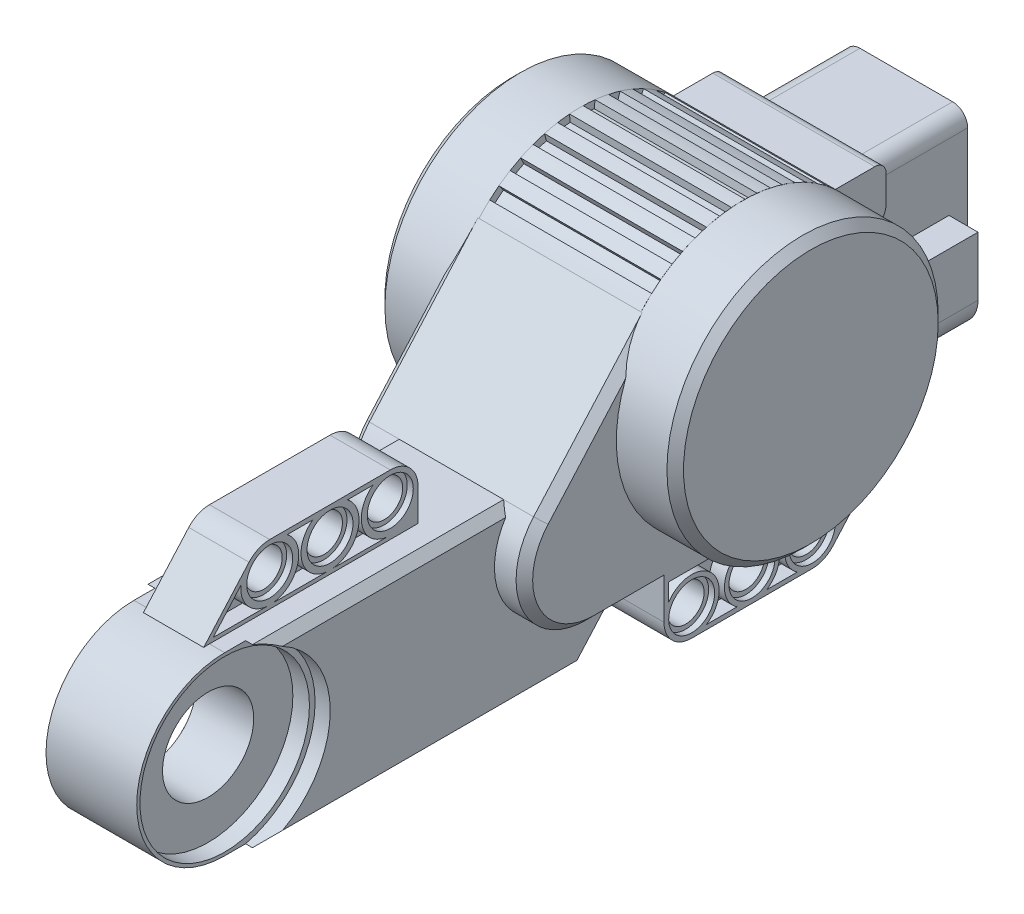
from build123d import *

# Parameters (mm, degrees)
SKETCH3_R                              = 18
MOTOR_BODY_DEPTH                       = 19.815
SKETCH4_R                              = 2.45
FRONT_TOP_PEG_TAB_DEPTH                = 4
SKETCH5_R                              = 3.05
PEG_COUNTERBORE_CUT_DEPTH              = 0.8
PEG_COUNTERBORE_LIN_PATTERN_COUNT      = 3
PEG_COUNTERBORE_LIN_PATTERN_PITCH      = 8
PEG_COUNTERBORE_MIRROR_COPY_1_SKETCH_R = 3.05
PEG_COUNTERBORE_MIRROR_COPY_1_DEPTH    = 0.8
PEG_COUNTERBORE_MIRROR_COPY_2_SKETCH_R = 3.05
PEG_COUNTERBORE_MIRROR_COPY_2_DEPTH    = 0.8
BODY_MOVE_COPY2_ANGLE                  = 180
SKETCH9_W                              = 24
SKETCH9_H                              = 31.675
BOTTOM_PEG_BASE_EXT_DEPTH              = 16
BK_PEG_BODY_HOLE_CUT_DEPTH             = 10
BACK_PEG_HOLES_BODY_START              = -12
BACK_PEG_HOLES_BODY_DEPTH              = 31.675
SKETCH12_R                             = 2.45
BACK_PEG_HOLES_CUT_DEPTH               = 8
FRONT_ARM_BODY_DEPTH                   = 8.03
SKETCH14_R                             = 12
L_WHEEL_RECESS_DEPTH                   = 2.01
ANGLED_MIDFRONT_BODY_DEPTH             = 12
SKETCH16_R                             = 3.05
BACK_PEG_HOLE_CNTRBORE_DEPTH           = 0.8
BACK_PEG_HOLE_CNTRBORE_PATTERN_COUNT   = 3
BACK_PEG_HOLE_CNTRBORE_PATTERN_PITCH   = 8
CHAMFER6_SIZE                          = 1.1
EXTRUDE1_DEPTH                         = 10
SKETCH18_W                             = 16.3
SKETCH18_H                             = 18.65
JACK_BODY_DEPTH                        = 45
JACK_FILLET_R                          = 2
SKETCH20_W                             = 21.5
SKETCH20_H                             = 31.471355086
CUT_EXTRUDE1_DEPTH                     = 91.332970033
EXTRUDE2_DEPTH                         = 10.75
SKETCH23_W                             = 11.1
SKETCH23_H                             = 14.25
CUT_EXTRUDE2_DEPTH                     = 12.5
SKETCH25_W                             = 11.1
SKETCH25_H                             = 14.25
EXTRUDE5_DEPTH                         = 12.5
CUT_EXTRUDE3_DEPTH                     = 2.3
CUT_EXTRUDE4_DEPTH                     = 9.9
SKETCH27_W                             = 6
SKETCH27_H                             = 2.5
CUT_EXTRUDE5_DEPTH                     = 3
CHAMFER7_SIZE                          = 1.1
CHAMFER8_SIZE                          = 1.1
CUT_EXTRUDE6_DEPTH                     = 2
CUT_EXTRUDE7_DEPTH                     = 2
MIRROR7_COPY_1_DEPTH                   = 2
CUT_EXTRUDE10_DEPTH                    = 2
SKETCH32_R                             = 6.05
CUT_EXTRUDE11_DEPTH                    = 98.123389819
SKETCH34_R                             = 11.25
CUT_EXTRUDE12_DEPTH                    = 2.2
SKETCH35_W                             = 8
SKETCH35_H                             = 22.425401663
EXTRUDE8_DEPTH                         = 0.01


with BuildPart() as part:
    # Sketch3 → motor_body (new, symmetric)
    with BuildSketch(Plane(origin=(0, 0, 0), x_dir=(0, 0, -1), z_dir=(1, 0, 0))):
        with Locations((-8, 24)):
            Circle(SKETCH3_R)
    extrude(amount=MOTOR_BODY_DEPTH, both=True)


with BuildPart() as body_2:
    # Sketch4 → front_top_peg_tab (new, symmetric)
    with BuildSketch(Plane(origin=(0, 0, 0), x_dir=(0, 0, -1), z_dir=(1, 0, 0))):
        with BuildLine():
            Line((-64, 27.675), (-48, 27.675))
            ThreePointArc((-48, 27.675), (-45.401382579, 26.598617421), (-44.325, 24))
            Line((-44.325, 24), (-44.325, 16))
            Line((-44.325, 16), (-76, 16))
            Line((-76, 16), (-66.750401663, 26.43739937))
            ThreePointArc((-66.750401663, 26.43739937), (-65.508009004, 27.351348063), (-64, 27.675))
        make_face()
        with Locations((-64, 24)):
            Circle(SKETCH4_R, mode=Mode.SUBTRACT)
        with Locations((-56, 24)):
            Circle(SKETCH4_R, mode=Mode.SUBTRACT)
        with Locations((-48, 24)):
            Circle(SKETCH4_R, mode=Mode.SUBTRACT)
    extrude(amount=FRONT_TOP_PEG_TAB_DEPTH, both=True)

    # Sketch5 → peg_counterbore_cut (cut)
    with BuildSketch(Plane(origin=(4, 0, 0), x_dir=(0, 0, -1), z_dir=(1, 0, 0))):
        with Locations((-64, 24)):
            Circle(SKETCH5_R)
    peg_counterbore_cut = extrude(amount=-PEG_COUNTERBORE_CUT_DEPTH, mode=Mode.SUBTRACT)

    # peg_counterbore_lin_pattern: peg_counterbore_cut ×3
    with Locations(*[(0, 0, -i * PEG_COUNTERBORE_LIN_PATTERN_PITCH) for i in range(1, PEG_COUNTERBORE_LIN_PATTERN_COUNT)]):
        add(peg_counterbore_cut, mode=Mode.SUBTRACT)

    # peg_counterbore_mirror: peg_counterbore_cut across plane
    add(peg_counterbore_cut.mirror(Plane(origin=(0, 0, 0), x_dir=(0, 0, 1), z_dir=(1, 0, 0))), mode=Mode.SUBTRACT)

    # peg_counterbore_mirror copy 1 sketch → peg_counterbore_mirror copy 1 (cut)
    with BuildSketch(Plane(origin=(-4, 0, -8), x_dir=(0, 0, -1), z_dir=(-1, 0, 0))):
        with Locations((-64, -24)):
            Circle(PEG_COUNTERBORE_MIRROR_COPY_1_SKETCH_R)
    extrude(amount=-PEG_COUNTERBORE_MIRROR_COPY_1_DEPTH, mode=Mode.SUBTRACT)

    # peg_counterbore_mirror copy 2 sketch → peg_counterbore_mirror copy 2 (cut)
    with BuildSketch(Plane(origin=(-4, 0, -16), x_dir=(0, 0, -1), z_dir=(-1, 0, 0))):
        with Locations((-64, -24)):
            Circle(PEG_COUNTERBORE_MIRROR_COPY_2_SKETCH_R)
    extrude(amount=-PEG_COUNTERBORE_MIRROR_COPY_2_DEPTH, mode=Mode.SUBTRACT)


with BuildPart() as body_3:
    # Body-Move/Copy1: copy of body 2
    add(body_2.part.moved(Location((0, 0, -64))))


with BuildPart() as body_3_1:
    # Body-Move/Copy2: moved
    add(body_3.part.rotate(Axis((0, 24, 0), (1, 0, 0)), BODY_MOVE_COPY2_ANGLE))


with BuildPart() as body_3_2:
    # Body-Move/Copy3: moved
    add(body_3_1.part.moved(Location((0, -24, 0))))


with BuildPart() as body_3_3:
    # Body-Move/Copy4: moved
    add(body_3_2.part.moved(Location((8, 0, 0))))


with BuildPart() as body_4:
    # Mirror2: mirrored copy
    add(body_3_3.part.mirror(Plane(origin=(0, 0, 0), x_dir=(0, 0, 1), z_dir=(1, 0, 0))))


with BuildPart() as body_5:
    # Sketch9 → bottom_peg_base_ext (new body)
    with BuildSketch(Plane(origin=(0, 8, 0), x_dir=(-1, 0, 0), z_dir=(0, 1, 0))):
        with Locations((0, 3.8375)):
            Rectangle(SKETCH9_W, SKETCH9_H)
    extrude(amount=BOTTOM_PEG_BASE_EXT_DEPTH)


with BuildPart() as bk_peg_body_hole_cut_tool:
    # Sketch8 → bk_peg_body_hole_cut (new body)
    with BuildSketch(Plane.XY.offset(-12)):
        with BuildLine():
            Line((8, 11.675), (-8, 11.675))
            ThreePointArc((-8, 11.675), (-11.675, 8), (-8, 4.325))
            Line((-8, 4.325), (8, 4.325))
            ThreePointArc((8, 4.325), (11.675, 8), (8, 11.675))
        make_face()
    extrude(amount=BK_PEG_BODY_HOLE_CUT_DEPTH)


with BuildPart() as part_1:
    add(part.part)

    # bk_peg_body_hole_cut: cut by bk_peg_body_hole_cut_tool
    add(bk_peg_body_hole_cut_tool.part, mode=Mode.SUBTRACT)


with BuildPart() as body_3_4:
    add(body_3_3.part)

    # bk_peg_body_hole_cut: cut by bk_peg_body_hole_cut_tool
    add(bk_peg_body_hole_cut_tool.part, mode=Mode.SUBTRACT)


with BuildPart() as body_4_1:
    add(body_4.part)

    # bk_peg_body_hole_cut: cut by bk_peg_body_hole_cut_tool
    add(bk_peg_body_hole_cut_tool.part, mode=Mode.SUBTRACT)


with BuildPart() as body_5_1:
    add(body_5.part)

    # bk_peg_body_hole_cut: cut by bk_peg_body_hole_cut_tool
    add(bk_peg_body_hole_cut_tool.part, mode=Mode.SUBTRACT)


with BuildPart() as body_6:
    # Sketch11 → back_peg_holes_body (new body)
    with BuildSketch(Plane.XY.offset(BACK_PEG_HOLES_BODY_START)):
        with BuildLine():
            Line((8, 11.675), (-8, 11.675))
            ThreePointArc((-8, 11.675), (-11.675, 8), (-8, 4.325))
            Line((-8, 4.325), (8, 4.325))
            ThreePointArc((8, 4.325), (11.675, 8), (8, 11.675))
        make_face()
    extrude(amount=BACK_PEG_HOLES_BODY_DEPTH)

    # Sketch12 → back_peg_holes_cut (cut)
    with BuildSketch(Plane.XY.offset(-12)):
        with Locations((0, 8)):
            Circle(SKETCH12_R)
        with Locations((-8, 8)):
            Circle(SKETCH12_R)
        with Locations((8, 8)):
            Circle(SKETCH12_R)
    extrude(amount=BACK_PEG_HOLES_CUT_DEPTH, mode=Mode.SUBTRACT)

    # Sketch16 → back_peg_hole_cntrbore (cut)
    with BuildSketch(Plane.XY.offset(-12)):
        with Locations((8, 8)):
            Circle(SKETCH16_R)
    back_peg_hole_cntrbore = extrude(amount=BACK_PEG_HOLE_CNTRBORE_DEPTH, mode=Mode.SUBTRACT)

    # back_peg_hole_cntrbore_pattern: back_peg_hole_cntrbore ×3
    with Locations(*[(-i * BACK_PEG_HOLE_CNTRBORE_PATTERN_PITCH, 0, 0) for i in range(1, BACK_PEG_HOLE_CNTRBORE_PATTERN_COUNT)]):
        add(back_peg_hole_cntrbore, mode=Mode.SUBTRACT)

    # Sketch31 → Cut-Extrude10 (cut)
    with BuildSketch(Plane.XY.offset(-12)):
        with BuildLine():
            Line((5.751250347, 10.875), (2.248749653, 10.875))
            ThreePointArc((2.248749653, 10.875), (3.65, 8), (2.248749653, 5.125))
            Line((2.248749653, 5.125), (5.751250347, 5.125))
            ThreePointArc((5.751250347, 5.125), (4.35, 8), (5.751250347, 10.875))
        make_face()
        with BuildLine():
            Line((-5.751250347, 5.125), (-2.248749653, 5.125))
            ThreePointArc((-2.248749653, 5.125), (-3.65, 8), (-2.248749653, 10.875))
            Line((-2.248749653, 10.875), (-5.751250347, 10.875))
            ThreePointArc((-5.751250347, 10.875), (-4.35, 8), (-5.751250347, 5.125))
        make_face()
    extrude(amount=CUT_EXTRUDE10_DEPTH, mode=Mode.SUBTRACT)


with BuildPart() as body_7:
    # Sketch13 → front_arm_body (new, symmetric)
    with BuildSketch(Plane(origin=(0, 0, 0), x_dir=(0, 0, -1), z_dir=(1, 0, 0))):
        with BuildLine():
            Line((-72, 19.675), (-19.675, 19.675))
            Line((-19.675, 19.675), (-19.675, 4.325))
            Line((-19.675, 4.325), (-26.764580849, -3.675))
            Line((-26.764580849, -3.675), (-72, -3.675))
            ThreePointArc((-72, -3.675), (-83.675, 8), (-72, 19.675))
        make_face()
    extrude(amount=FRONT_ARM_BODY_DEPTH, both=True)

    # Sketch14 → l_wheel_recess (cut)
    with BuildSketch(Plane(origin=(8.03, 0, 0), x_dir=(0, 0, -1), z_dir=(1, 0, 0))):
        with Locations((-72, 8)):
            Circle(SKETCH14_R)
    l_wheel_recess = extrude(amount=-L_WHEEL_RECESS_DEPTH, mode=Mode.SUBTRACT)

    # r_wheel_recess_mirror: l_wheel_recess across plane
    add(l_wheel_recess.mirror(Plane(origin=(0, 0, 0), x_dir=(0, 0, 1), z_dir=(1, 0, 0))), mode=Mode.SUBTRACT)


with BuildPart() as body_8:
    # Sketch15 → angled_midfront_body (new, symmetric)
    with BuildSketch(Plane(origin=(0, 0, 0), x_dir=(0, 0, -1), z_dir=(1, 0, 0))):
        with BuildLine():
            Line((-19.675, 4.325), (-28.976784364, 4.325))
            ThreePointArc((-28.976784364, 4.325), (-37.392987177, 9.766940189), (-35.883837221, 19.675))
            Line((-35.883837221, 19.675), (-21.471355086, 35.938282629))
            Line((-21.471355086, 35.938282629), (-5.275310501, 4.325))
            Line((-5.275310501, 4.325), (-19.675, 4.325))
        make_face()
    extrude(amount=ANGLED_MIDFRONT_BODY_DEPTH, both=True)

    # Chamfer6
    chamfer6_edges = [body_8.edges().sort_by_distance(p)[0] for p in [
        (12, 27.806641315, 28.677596154),
        (12, 9.766940189, 37.392987177),
        (12, 4.325, 17.126047432),
        (-12, 4.325, 17.126047432),
        (-12, 9.766940189, 37.392987177),
        (-12, 27.806641315, 28.677596154),
    ]]
    chamfer(chamfer6_edges, length=CHAMFER6_SIZE)


with BuildPart() as body_2_1:
    add(body_2.part)

    # Combine1: union body 7
    add(body_7.part)

    # Combine2: union body 8, part, body 3, body 4, body 5
    add(body_8.part)
    add(part_1.part)
    add(body_3_4.part)
    add(body_4_1.part)
    add(body_5_1.part)

    # Sketch17 → Extrude1 (add)
    with BuildSketch(Plane(origin=(0, 0, -12), x_dir=(-1, 0, 0), z_dir=(0, 0, -1))):
        with BuildLine():
            Line((-8, 12.175), (8, 12.175))
            ThreePointArc((8, 12.175), (10.828427125, 13.346572875), (12, 16.175))
            Line((12, 16.175), (12, 24))
            Line((12, 24), (-12, 24))
            Line((-12, 24), (-12, 16.175))
            ThreePointArc((-12, 16.175), (-10.828427125, 13.346572875), (-8, 12.175))
        make_face()
    extrude(amount=EXTRUDE1_DEPTH)

    # Sketch20 → Cut-Extrude1 (cut, through all)
    with BuildSketch(Plane(origin=(0, 24, 0), x_dir=(-1, 0, 0), z_dir=(0, 1, 0))):
        with Locations((0, 5.735677543)):
            Rectangle(SKETCH20_W, SKETCH20_H)
    extrude(amount=CUT_EXTRUDE1_DEPTH, mode=Mode.SUBTRACT)


with BuildPart() as body_3_2_1:
    # Sketch18 → jack_body (new body)
    with BuildSketch(Plane(origin=(0, 0, -24.48), x_dir=(-1, 0, 0), z_dir=(0, 0, -1))):
        with Locations((0, 25.5)):
            Rectangle(SKETCH18_W, SKETCH18_H)
    extrude(amount=-JACK_BODY_DEPTH)

    # jack_fillet
    jack_fillet_edges = [body_3_2_1.edges().sort_by_distance(p)[0] for p in [
        (8.15, 34.825, -1.98),
        (-8.15, 34.825, -1.98),
        (-8.15, 16.175, -1.98),
        (8.15, 16.175, -1.98),
    ]]
    fillet(jack_fillet_edges, radius=JACK_FILLET_R)


with BuildPart() as body_4_2:
    # Sketch21 → Extrude2 (new, symmetric)
    with BuildSketch(Plane(origin=(0, 0, 0), x_dir=(0, 0, -1), z_dir=(1, 0, 0))):
        with BuildLine():
            Line((-21.471355086, 24), (-21.471355086, 35.938282629))
            ThreePointArc((-21.471355086, 35.938282629), (-20.787311968, 36.668253732), (-20.063771338, 37.35909507))
            Line((-20.063771338, 37.35909507), (-19.393561819, 36.616923122))
            ThreePointArc((-19.393561819, 36.616923122), (-18.825839432, 37.107295701), (-18.237035728, 37.572144248))
            Line((-18.237035728, 37.572144248), (-18.8392143, 38.370505675))
            ThreePointArc((-18.8392143, 38.370505675), (-18.10713152, 38.894492017), (-17.349765099, 39.381218827))
            Line((-17.349765099, 39.381218827), (-16.830333704, 38.52670667))
            ThreePointArc((-16.830333704, 38.52670667), (-16.180851867, 38.90213618), (-15.515439336, 39.24854654))
            Line((-15.515439336, 39.24854654), (-15.957524002, 40.145519866))
            ThreePointArc((-15.957524002, 40.145519866), (-15.140294879, 40.523201537), (-14.305203849, 40.859549354))
            Line((-14.305203849, 40.859549354), (-13.954914746, 39.922907723))
            ThreePointArc((-13.954914746, 39.922907723), (-13.246635476, 40.170121094), (-12.528139355, 40.385846148))
            Line((-12.528139355, 40.385846148), (-12.794500494, 41.349719451))
            ThreePointArc((-12.794500494, 41.349719451), (-11.921017645, 41.567743755), (-11.037726118, 41.741821215))
            Line((-11.037726118, 41.741821215), (-10.868963556, 40.756164481))
            ThreePointArc((-10.868963556, 40.756164481), (-10.126927618, 40.866421639), (-9.380749882, 40.943834565))
            Line((-9.380749882, 40.943834565), (-9.461970464, 41.940530716))
            ThreePointArc((-9.461970464, 41.940530716), (-8.563115321, 41.991189542), (-7.662851509, 41.996842248))
            Line((-7.662851509, 41.996842248), (-7.681581981, 40.997017679))
            ThreePointArc((-7.681581981, 40.997017679), (-6.932023584, 40.966420553), (-6.184544874, 40.902784465))
            Line((-6.184544874, 40.902784465), (-6.077753395, 41.897065905))
            ThreePointArc((-6.077753395, 41.897065905), (-5.185304412, 41.778568242), (-4.299896571, 41.615596346))
            Line((-4.299896571, 41.615596346), (-4.505457873, 40.636952104))
            ThreePointArc((-4.505457873, 40.636952104), (-3.774877179, 40.466582437), (-3.052524128, 40.264147149))
            Line((-3.052524128, 40.264147149), (-2.761496136, 41.220861688))
            ThreePointArc((-2.761496136, 41.220861688), (-1.907005279, 40.937396947), (-1.067756441, 40.611562216))
            Line((-1.067756441, 40.611562216), (-1.452881083, 39.688697648))
            ThreePointArc((-1.452881083, 39.688697648), (-0.767107309, 39.38457875), (-0.095418253, 39.050501234))
            Line((-0.095418253, 39.050501234), (0.369557144, 39.935824836))
            ThreePointArc((0.369557144, 39.935824836), (1.155879893, 39.497414732), (1.919298618, 39.020236847))
            Line((1.919298618, 39.020236847), (1.368226472, 38.185779244))
            ThreePointArc((1.368226472, 38.185779244), (1.984948231, 37.758663046), (2.582226153, 37.3047544))
            Line((2.582226153, 37.3047544), (3.204710044, 38.087387012))
            ThreePointArc((3.204710044, 38.087387012), (3.768455249, 37.61996553), (4.312721064, 37.13))
            Line((4.312721064, 37.13), (9.55, 37.13))
            ThreePointArc((9.55, 37.13), (10.610660172, 36.690660172), (11.05, 35.63))
            Line((11.05, 35.63), (11.05, 32.062430634))
            ThreePointArc((11.05, 32.062430634), (10.479354691, 30.542036776), (9.049263645, 29.772573876))
            Line((9.049263645, 29.772573876), (9.049263645, 24))
            Line((9.049263645, 24), (-21.471355086, 24))
        make_face()
    extrude(amount=EXTRUDE2_DEPTH, both=True)

    # Combine3: union body 3 2
    add(body_3_2_1.part)


with BuildPart() as cut_extrude2_tool:
    # Sketch23 → Cut-Extrude2 (new body)
    with BuildSketch(Plane(origin=(0, 0, -24.48), x_dir=(-1, 0, 0), z_dir=(0, 0, -1))):
        with Locations((0, 25.1)):
            Rectangle(SKETCH23_W, SKETCH23_H)
    extrude(amount=-CUT_EXTRUDE2_DEPTH)


with BuildPart() as body_2_2:
    add(body_2_1.part)

    # Cut-Extrude2: cut by cut_extrude2_tool
    add(cut_extrude2_tool.part, mode=Mode.SUBTRACT)

    # Chamfer7
    chamfer7_edges = [body_2_2.edges().sort_by_distance(p)[0] for p in [
        (-19.815, 24, 26),
        (19.815, 24, 26),
    ]]
    chamfer(chamfer7_edges, length=CHAMFER7_SIZE)

    # Chamfer8
    # the kernel refuses this chamfer: 1.1 mm, written as the material it takes off along each edge
    with BuildSketch(Plane(origin=(-8.03, 19.675, 72.054977641), x_dir=(0.9996219169112966, 0.02749587661058657, 0), z_dir=(0, 0, -1))) as chamfer8_piece_1_section:
        Polygon((CHAMFER8_SIZE * 0.999621916911, CHAMFER8_SIZE * 0.0274958766106), (-CHAMFER8_SIZE * 0.0274958766106, CHAMFER8_SIZE * 0.999621916911), (0, 0), align=None)
    chamfer8_piece_1 = extrude(amount=38.999991707, mode=Mode.PRIVATE)
    chamfer8_piece_1 = chamfer8_piece_1 - Plane(origin=(-7.66621157, 13.553986292, 28.976784364), x_dir=(0, -1, 0), z_dir=(1, 0, 0)) * Cylinder(9.228986292, 83, mode=Mode.PRIVATE)
    add(chamfer8_piece_1, mode=Mode.SUBTRACT)
    with BuildSketch(Plane(origin=(-8.03, -3.675, 23.935729563), x_dir=(-0.02749587661058658, 0.9996219169112966, 0), z_dir=(0, 0, 1))) as chamfer8_piece_2:
        Polygon((CHAMFER8_SIZE * 0.999621916911, -CHAMFER8_SIZE * 0.0274958766106), (-CHAMFER8_SIZE * 0.0274958766106, -CHAMFER8_SIZE * 0.999621916911), (0, 0), align=None)
    extrude(amount=48.119248079, mode=Mode.SUBTRACT)
    with BuildSketch(Plane(origin=(-8.03, 6.442136676, 17.798798546), x_dir=(0.9996219169112966, -0.018236308117804544, -0.02057815095719529), z_dir=(0, -0.7484086159039549, 0.6632379238559316))) as chamfer8_piece_3_section:
        Polygon((CHAMFER8_SIZE * 0.999621916911, CHAMFER8_SIZE * 0.0274958766106), (-CHAMFER8_SIZE * 0.0274958766106, CHAMFER8_SIZE * 0.999621916911), (0, 0), align=None)
    chamfer8_piece_3 = extrude(amount=16.347050384, mode=Mode.PRIVATE)
    chamfer8_piece_3 = split(chamfer8_piece_3, bisect_by=Plane(origin=(-7.664513122, -0.615510317, 19.675), z_dir=(0, 0, 1)), keep=Keep.TOP, mode=Mode.PRIVATE)
    chamfer8_piece_3 = split(chamfer8_piece_3, bisect_by=Plane(origin=(-7.664513122, 4.325, 24.531154905), z_dir=(0, -1, 0)), keep=Keep.TOP, mode=Mode.PRIVATE)
    add(chamfer8_piece_3, mode=Mode.SUBTRACT)
    with BuildSketch(Plane(origin=(8.03, -3.675, 23.935729563), x_dir=(0.02749587661058658, 0.9996219169112966, 0), z_dir=(0, 0, 1))) as chamfer8_piece_4:
        Polygon((CHAMFER8_SIZE * 0.999621916911, CHAMFER8_SIZE * 0.0274958766106), (-CHAMFER8_SIZE * 0.0274958766106, CHAMFER8_SIZE * 0.999621916911), (0, 0), align=None)
    extrude(amount=48.119248079, mode=Mode.SUBTRACT)
    with BuildSketch(Plane(origin=(8.03, 6.442136676, 17.798798546), x_dir=(-0.9996219169112966, -0.018236308117804544, -0.02057815095719529), z_dir=(0, -0.7484086159039549, 0.6632379238559316))) as chamfer8_piece_5_section:
        Polygon((CHAMFER8_SIZE * 0.999621916911, -CHAMFER8_SIZE * 0.0274958766106), (-CHAMFER8_SIZE * 0.0274958766106, -CHAMFER8_SIZE * 0.999621916911), (0, 0), align=None)
    chamfer8_piece_5 = extrude(amount=16.347050384, mode=Mode.PRIVATE)
    chamfer8_piece_5 = split(chamfer8_piece_5, bisect_by=Plane(origin=(7.664513122, -0.615510317, 19.675), z_dir=(0, 0, 1)), keep=Keep.TOP, mode=Mode.PRIVATE)
    chamfer8_piece_5 = split(chamfer8_piece_5, bisect_by=Plane(origin=(7.664513122, 4.325, 24.531154905), z_dir=(0, -1, 0)), keep=Keep.TOP, mode=Mode.PRIVATE)
    add(chamfer8_piece_5, mode=Mode.SUBTRACT)
    with BuildSketch(Plane(origin=(8.03, 19.675, 72.054977641), x_dir=(-0.9996219169112966, 0.02749587661058657, 0), z_dir=(0, 0, -1))) as chamfer8_piece_6_section:
        Polygon((CHAMFER8_SIZE * 0.999621916911, -CHAMFER8_SIZE * 0.0274958766106), (-CHAMFER8_SIZE * 0.0274958766106, -CHAMFER8_SIZE * 0.999621916911), (0, 0), align=None)
    chamfer8_piece_6 = extrude(amount=38.999991707, mode=Mode.PRIVATE)
    chamfer8_piece_6 = chamfer8_piece_6 - Plane(origin=(7.66621157, 13.553986292, 28.976784364), x_dir=(0, -1, 0), z_dir=(1, 0, 0)) * Cylinder(9.228986292, 83, mode=Mode.PRIVATE)
    add(chamfer8_piece_6, mode=Mode.SUBTRACT)

    # Sketch28 → Cut-Extrude6 (cut)
    with BuildSketch(Plane(origin=(4, 0, 0), x_dir=(0, 0, -1), z_dir=(1, 0, 0))):
        with BuildLine():
            Line((-58.316651679, 27.075), (-61.683348321, 27.075))
            ThreePointArc((-61.683348321, 27.075), (-60.285222051, 22.988602554), (-63.561964613, 20.175))
            Line((-63.561964613, 20.175), (-56.438035387, 20.175))
            ThreePointArc((-56.438035387, 20.175), (-59.714777949, 22.988602554), (-58.316651679, 27.075))
        make_face()
        with BuildLine():
            Line((-64.438035387, 20.175), (-71.498423908, 20.175))
            Line((-71.498423908, 20.175), (-67.837847744, 24.30565454))
            ThreePointArc((-67.837847744, 24.30565454), (-66.972603382, 21.553343274), (-64.438035387, 20.175))
        make_face()
        with BuildLine():
            Line((-48.438035387, 20.175), (-55.561964613, 20.175))
            ThreePointArc((-55.561964613, 20.175), (-52.285222051, 22.988602554), (-53.683348321, 27.075))
            Line((-53.683348321, 27.075), (-50.316651679, 27.075))
            ThreePointArc((-50.316651679, 27.075), (-51.714777949, 22.988602554), (-48.438035387, 20.175))
        make_face()
    cut_extrude6 = extrude(amount=-CUT_EXTRUDE6_DEPTH, mode=Mode.SUBTRACT)

    # Mirror3: Cut-Extrude6 across plane
    add(cut_extrude6.mirror(Plane(origin=(0, 0, 0), x_dir=(0, 0, 1), z_dir=(1, 0, 0))), mode=Mode.SUBTRACT)

    # Sketch29 → Cut-Extrude7 (cut)
    with BuildSketch(Plane(origin=(12, 0, 0), x_dir=(0, 0, -1), z_dir=(1, 0, 0))):
        with BuildLine():
            Line((-19.075, 4.325), (7.674289016, 4.325))
            Line((7.674289016, 4.325), (3.643130822, -0.223825416))
            ThreePointArc((3.643130822, -0.223825416), (-1.653821199, 3.253824741), (-1.966437133, -3.075))
            Line((-1.966437133, -3.075), (-6.033562867, -3.075))
            ThreePointArc((-6.033562867, -3.075), (-8, 3.65), (-9.966437133, -3.075))
            Line((-9.966437133, -3.075), (-14.033562867, -3.075))
            ThreePointArc((-14.033562867, -3.075), (-13.419060249, 2.580939751), (-19.075, 1.966437133))
            Line((-19.075, 1.966437133), (-19.075, 4.325))
        make_face()
    cut_extrude7 = extrude(amount=-CUT_EXTRUDE7_DEPTH, mode=Mode.SUBTRACT)

    # Mirror4: Cut-Extrude7 across plane
    add(cut_extrude7.mirror(Plane(origin=(0, 0, 0), x_dir=(0, 0, 1), z_dir=(1, 0, 0))), mode=Mode.SUBTRACT)

    # Mirror6: Cut-Extrude7 across plane
    add(cut_extrude7.mirror(Plane(origin=(8.075, 0, 0), x_dir=(0, 0, 1), z_dir=(1, 0, 0))), mode=Mode.SUBTRACT)

    # Mirror7 copy 1 sketch → Mirror7 copy 1 (cut)
    with BuildSketch(Plane(origin=(-4.15, 0, 0), x_dir=(0, 0, -1), z_dir=(1, 0, 0))):
        with BuildLine():
            Line((-19.075, 4.325), (7.674289016, 4.325))
            Line((7.674289016, 4.325), (3.643130822, -0.223825416))
            ThreePointArc((3.643130822, -0.223825416), (-1.653821199, 3.253824741), (-1.966437133, -3.075))
            Line((-1.966437133, -3.075), (-6.033562867, -3.075))
            ThreePointArc((-6.033562867, -3.075), (-8, 3.65), (-9.966437133, -3.075))
            Line((-9.966437133, -3.075), (-14.033562867, -3.075))
            ThreePointArc((-14.033562867, -3.075), (-13.419060249, 2.580939751), (-19.075, 1.966437133))
            Line((-19.075, 1.966437133), (-19.075, 4.325))
        make_face()
    extrude(amount=-MIRROR7_COPY_1_DEPTH, mode=Mode.SUBTRACT)

    # Sketch32 → Cut-Extrude11 (cut, through all)
    with BuildSketch(Plane(origin=(6.02, 0, 0), x_dir=(0, 0, -1), z_dir=(1, 0, 0))):
        with Locations((-72, 8)):
            Circle(SKETCH32_R)
    extrude(amount=-CUT_EXTRUDE11_DEPTH, mode=Mode.SUBTRACT)

    # Sketch34 → Cut-Extrude12 (cut)
    with BuildSketch(Plane(origin=(6.02, 0, 0), x_dir=(0, 0, -1), z_dir=(1, 0, 0))):
        with Locations((-72, 8)):
            Circle(SKETCH34_R)
    cut_extrude12 = extrude(amount=-CUT_EXTRUDE12_DEPTH, mode=Mode.SUBTRACT)

    # Mirror8: Cut-Extrude12 across plane
    add(cut_extrude12.mirror(Plane(origin=(0, 0, 0), x_dir=(0, 0, 1), z_dir=(1, 0, 0))), mode=Mode.SUBTRACT)


with BuildPart() as body_4_2_1:
    add(body_4_2.part)

    # Cut-Extrude2: cut by cut_extrude2_tool
    add(cut_extrude2_tool.part, mode=Mode.SUBTRACT)


with BuildPart() as body_4_3:
    # Sketch25 → Extrude5 (new body)
    with BuildSketch(Plane(origin=(0, 0, -11.98), x_dir=(-1, 0, 0), z_dir=(0, 0, -1))):
        with Locations((0, 25.1)):
            Rectangle(SKETCH25_W, SKETCH25_H)
    extrude(amount=EXTRUDE5_DEPTH)

    # Sketch22 → Cut-Extrude3 (cut)
    with BuildSketch(Plane(origin=(0, 0, -24.48), x_dir=(-1, 0, 0), z_dir=(0, 0, -1))):
        Polygon((-4.925, 17.975), (4.925, 17.975), (4.925, 28.265), (3.79, 28.265), (3.79, 31.875), (0.49, 31.875), (0.49, 28.265), (-0.645, 28.265), (-0.645, 26.765), (-4.925, 26.765), align=None)
    extrude(amount=-CUT_EXTRUDE3_DEPTH, mode=Mode.SUBTRACT)

    # Sketch26 → Cut-Extrude4 (cut)
    with BuildSketch(Plane(origin=(0, 0, -22.18), x_dir=(-1, 0, 0), z_dir=(0, 0, -1))):
        Polygon((-4.925, 21.175), (4.925, 21.175), (4.925, 28.265), (3.79, 28.265), (3.79, 31.875), (0.49, 31.875), (0.49, 28.265), (-0.645, 28.265), (-0.645, 26.765), (-4.925, 26.765), align=None)
    extrude(amount=-CUT_EXTRUDE4_DEPTH, mode=Mode.SUBTRACT)

    # Sketch27 → Cut-Extrude5 (cut)
    with BuildSketch(Plane(origin=(0, 0, -22.18), x_dir=(-1, 0, 0), z_dir=(0, 0, -1))):
        with Locations((0, 19.925)):
            Rectangle(SKETCH27_W, SKETCH27_H)
    extrude(amount=-CUT_EXTRUDE5_DEPTH, mode=Mode.SUBTRACT)


with BuildPart() as body_5_2:
    # Sketch35 → Extrude8 (new body)
    with BuildSketch(Plane.XZ.offset(-4.325)):
        with Locations((0, 8.462299168)):
            Rectangle(SKETCH35_W, SKETCH35_H)
    extrude(amount=EXTRUDE8_DEPTH)


solid = Compound([body_6.part, body_2_2.part, body_4_2_1.part, body_4_3.part, body_5_2.part])
